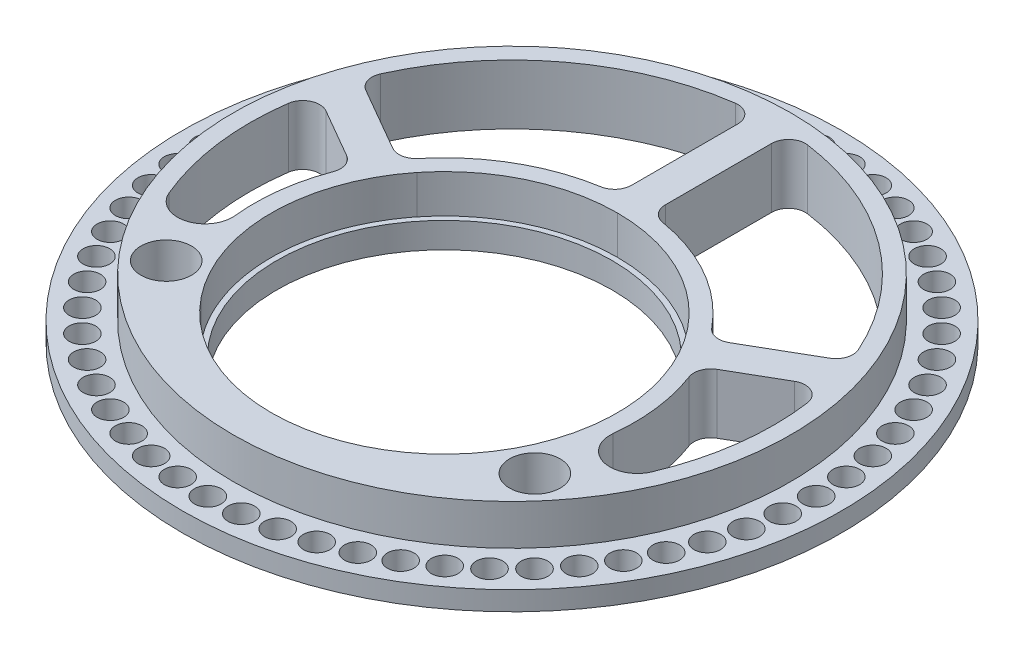
from build123d import *

# Parameters (mm, degrees)
SLOTTED_BODY_EXTRUDE_DEPTH      = 4.191
SLOTTED_BODY_EXTRUDE_DEPTH_BACK = 0.2032
SKETCH1_R                       = 61.9125
SKETCH1_R_2                     = 30.988
SKETCH5_R                       = 52.3875
BOSS_EXTRUDE3_DEPTH             = 7.62
SKETCH6_R                       = 32.512
CUT_EXTRUDE5_DEPTH              = 89.377917571
SKETCH8_R                       = 32.512
SKETCH8_R_2                     = 31.496
BOSS_EXTRUDE4_DEPTH             = 4.795000062
SKETCH13_R                      = 5.159375
CUT_EXTRUDE7_DEPTH              = 36.068
FILLET1_R                       = 3.175
MOVE_START                      = -0.2032
MOVE_FACE2_OUTLINE_R            = 61.9125
MOVE_FACE2_DEPTH                = 0.79375
SKETCH13_5_R                    = 3.175
CUT_EXTRUDE9_DEPTH              = 89.377917571
MOVE_FACE3_BY                   = 1.5875
MOVE_FACE3_2_BY                 = 1.5875
SKETCH14_R                      = 2.5
CUT_EXTRUDE10_DEPTH             = 88.888450393
CIRPATTERN1_COUNT               = 60


# Read off the part's stored shape, not the designer's step: Move Face2
with BuildPart() as part:
    # Sketch1 → Slotted-Body Extrude (new, two sides: drawn at the far end of the back side and taken through both)
    with BuildSketch(Plane(origin=(0, 0, 0), x_dir=(1, 0, 0), z_dir=(0, 1, 0)).offset(-SLOTTED_BODY_EXTRUDE_DEPTH_BACK)):
        with Locations(Location((0, 0, 0), (0, 0, 270))):
            Circle(SKETCH1_R)
        with Locations(Location((0, -12.7, 0), (0, 0, 270))):
            Circle(SKETCH1_R_2, mode=Mode.SUBTRACT)
    extrude(amount=SLOTTED_BODY_EXTRUDE_DEPTH + SLOTTED_BODY_EXTRUDE_DEPTH_BACK)

    # Sketch5 → Boss-Extrude3 (add)
    with BuildSketch(Plane(origin=(0, 4.191, 0), x_dir=(1, 0, 0), z_dir=(0, 1, 0))):
        with Locations(Location((0, 0, 0), (0, 0, 90))):
            Circle(SKETCH5_R)
    extrude(amount=BOSS_EXTRUDE3_DEPTH)

    # Sketch6 → Cut-Extrude5 (cut, through all)
    with BuildSketch(Plane.XZ.offset(0.2032)):
        with Locations(Location((0, 12.7, 0), (0, 0, 270))):
            Circle(SKETCH6_R)
    extrude(amount=-CUT_EXTRUDE5_DEPTH, mode=Mode.SUBTRACT)

    # Sketch13 → Cut-Extrude7 (cut)
    with BuildSketch(Plane(origin=(0, 11.811, 0), x_dir=(1, 0, 0), z_dir=(0, 1, 0))):
        with Locations((-40.612092014, -17.068561875)):
            Circle(SKETCH13_R)
        with BuildLine():
            ThreePointArc((-35.482309697, -16.516761399), (-35.210027203, -6.884851392), (-32.370791052, 2.323110718))
            Line((-32.370791052, 2.323110718), (-47.900191204, 11.289014077))
            ThreePointArc((-47.900191204, 11.289014077), (-49.04223906, -4.09010321), (-45.36846312, -19.06758271))
            ThreePointArc((-45.36846312, -19.06758271), (-41.901096019, -12.072801766), (-35.482309697, -16.516761399))
        make_face()
        with BuildLine():
            Line((-45.989035316, 17.517956129), (-29.195791052, 7.822372033))
            ThreePointArc((-29.195791052, 7.822372033), (-17.8435, 18.205848585), (-3.175, 22.845482751))
            Line((-3.175, 22.845482751), (-3.175, 49.109973847))
            ThreePointArc((-3.175, 49.109973847), (-29.219676385, 39.598998324), (-45.989035316, 17.517956129))
        make_face()
        with BuildLine():
            Line((3.175, 49.109973847), (3.175, 22.845482751))
            ThreePointArc((3.175, 22.845482751), (17.8435, 18.205848585), (29.195791052, 7.822372033))
            Line((29.195791052, 7.822372033), (45.989035316, 17.517956129))
            ThreePointArc((45.989035316, 17.517956129), (29.219676385, 39.598998324), (3.175, 49.109973847))
        make_face()
        with BuildLine():
            Line((47.900191204, 11.289014077), (32.370791052, 2.323110718))
            ThreePointArc((32.370791052, 2.323110718), (34.848087389, -5.007615821), (35.687, -12.7))
            ThreePointArc((35.687, -12.7), (35.635790683, -14.611123079), (35.482309697, -16.516761399))
            ThreePointArc((35.482309697, -16.516761399), (40.888388726, -11.916590357), (45.771467014, -17.068561875))
            ThreePointArc((45.771467014, -17.068561875), (45.669712629, -18.088181465), (45.36846312, -19.06758271))
            ThreePointArc((45.36846312, -19.06758271), (48.241919777, -9.725601908), (49.2125, 0))
            ThreePointArc((49.2125, 0), (48.883321879, 5.682516898), (47.900191204, 11.289014077))
        make_face()
        with Locations((40.612092014, -17.068561875)):
            Circle(SKETCH13_R)
    extrude(amount=-CUT_EXTRUDE7_DEPTH, mode=Mode.SUBTRACT)

    # Fillet1
    fillet1_edges = [part.edges().sort_by_distance(p)[0] for p in [
        (-3.175, 5.8039, -22.845482751),
        (-29.195791052, 5.8039, -7.822372033),
        (-45.989035316, 5.8039, -17.517956129),
        (-3.175, 5.8039, -49.109973847),
        (29.195791052, 5.8039, -7.822372033),
        (3.175, 5.8039, -22.845482751),
        (3.175, 5.8039, -49.109973847),
        (45.989035316, 5.8039, -17.517956129),
        (32.370791052, 5.8039, -2.323110718),
        (47.900191204, 5.8039, -11.289014077),
        (-47.900191204, 5.8039, -11.289014077),
        (-32.370791052, 5.8039, -2.323110718),
    ]]
    fillet(fillet1_edges, radius=FILLET1_R)

    # Move Face2 outline → Move Face2 (cut)
    with BuildSketch(Plane(origin=(0, 0, 0), x_dir=(1, 0, 0), z_dir=(0, 1, 0)).offset(MOVE_START)):
        Circle(MOVE_FACE2_OUTLINE_R)
    extrude(amount=MOVE_FACE2_DEPTH, mode=Mode.SUBTRACT)

    # Sketch13<5> → Cut-Extrude9 (cut, through all)
    with BuildSketch(Plane(origin=(0, 11.811, 0), x_dir=(1, 0, 0), z_dir=(0, 1, 0))):
        with Locations(Location((-34.630813629, -30.33410875, 0), (0, 0, 270))):
            Circle(SKETCH13_5_R)
        with Locations(Location((34.630813629, -30.33410875, 0), (0, 0, 270))):
            Circle(SKETCH13_5_R)
    extrude(amount=-CUT_EXTRUDE9_DEPTH, mode=Mode.SUBTRACT)

    # Move Face3: a curved face moved inward by 1.5875
    add(Solid.thicken(part.faces().sort_by_distance((34.630813629, 6.200775, 27.15910875))[0], -MOVE_FACE3_BY), mode=Mode.SUBTRACT)

    # Move Face3 2: a curved face moved inward by 1.5875
    add(Solid.thicken(part.faces().sort_by_distance((-34.630813629, 6.200775, 27.15910875))[0], -MOVE_FACE3_2_BY), mode=Mode.SUBTRACT)

    # Sketch14 → Cut-Extrude10 (cut, through all)
    with BuildSketch(Plane(origin=(0, 4.191, 0), x_dir=(1, 0, 0), z_dir=(0, 1, 0))):
        with Locations(Location((0, 57.15, 0), (0, 0, 270))):
            Circle(SKETCH14_R)
    cut_extrude10 = extrude(amount=-CUT_EXTRUDE10_DEPTH, mode=Mode.SUBTRACT)

    # CirPattern1: Cut-Extrude10 ×60 about axis
    cirpattern1_axis = Axis((0, 0, 0), (0, 1, 0))
    for i in range(1, CIRPATTERN1_COUNT):
        add(cut_extrude10.rotate(cirpattern1_axis, i * 360 / CIRPATTERN1_COUNT), mode=Mode.SUBTRACT)


with BuildPart() as body_2:
    # Sketch8 → Boss-Extrude4 (new body)
    with BuildSketch(Plane.XZ.offset(0.2032)):
        with Locations(Location((0, 12.7, 0), (0, 0, 270))):
            Circle(SKETCH8_R)
        with Locations(Location((0, 12.7, 0), (0, 0, 270))):
            Circle(SKETCH8_R_2, mode=Mode.SUBTRACT)
    extrude(amount=-BOSS_EXTRUDE4_DEPTH)


solid = Compound([part.part, body_2.part])
